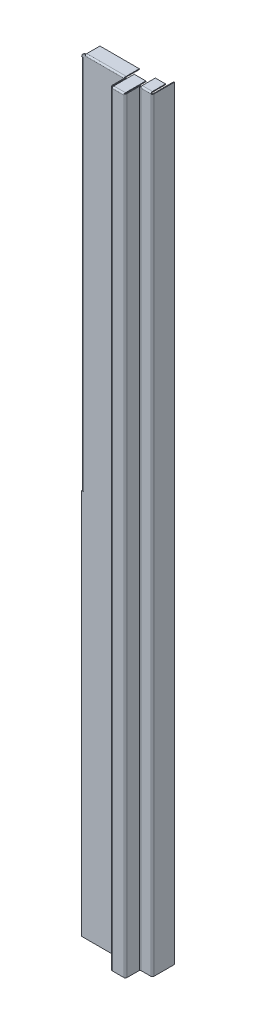
from build123d import *

# Parameters (mm, degrees)
BASE_FLANGE1_DEPTH             = 1050
CUT_EXTRUDE1_REACH             = 1056.479
EDGE_FLANGE5_STRIP_W           = 16
EDGE_FLANGE5_STRIP_H           = 1
EDGE_FLANGE5_STRIP_CUT_DEPTH   = 54
EDGE_FLANGE5_STRIP_2_W         = 16
EDGE_FLANGE5_STRIP_2_H         = 1
EDGE_FLANGE5_STRIP_CUT_2_DEPTH = 14
EDGE_FLANGE5_DEPTH             = 54
EDGE_FLANGE5_BEND_DEPTH        = 14
EDGE_FLANGE7_DEPTH             = 1048
EDGE_FLANGE8_STRIP_W           = 6
EDGE_FLANGE8_STRIP_H           = 1
EDGE_FLANGE8_STRIP_CUT_DEPTH   = 16
EDGE_FLANGE8_DEPTH             = 16
EDGE_FLANGE9_START             = 529.5
EDGE_FLANGE9_DEPTH             = 515.5
EDGE_FLANGE9_2_DEPTH           = 0.5
EDGE_FLANGE9_START_2           = 530
EDGE_FLANGE9_3_DEPTH           = 515


# Read off the part's stored shape, not the designer's step: Edge-Flange9
# Sheet-metal steps are written as plain solids
with BuildPart() as part:
    # Sketch1 → Base-Flange1 (new body)
    with BuildSketch(Plane(origin=(0, 0, 0), x_dir=(1, 0, 0), z_dir=(0, 1, 0))):
        with BuildLine():
            Line((0, 0), (-14, 0))
            ThreePointArc((-14, 0), (-14.707106781, -0.292893219), (-15, -1))
            Line((-15, -1), (-15, -18))
            ThreePointArc((-15, -18), (-15.585786438, -19.414213562), (-17, -20))
            Line((-17, -20), (-33, -20))
            ThreePointArc((-33, -20), (-34.414213562, -19.414213562), (-35, -18))
            Line((-35, -18), (-35, -1))
            ThreePointArc((-35, -1), (-35.292893219, -0.292893219), (-36, 0))
            Line((-36, 0), (-95, 0))
            Line((-95, 0), (-95, 1))
            Line((-95, 1), (-36, 1))
            ThreePointArc((-36, 1), (-34.585786438, 0.414213562), (-34, -1))
            Line((-34, -1), (-34, -18))
            ThreePointArc((-34, -18), (-33.707106781, -18.707106781), (-33, -19))
            Line((-33, -19), (-17, -19))
            ThreePointArc((-17, -19), (-16.292893219, -18.707106781), (-16, -18))
            Line((-16, -18), (-16, -1))
            ThreePointArc((-16, -1), (-15.414213562, 0.414213562), (-14, 1))
            Line((-14, 1), (0, 1))
            Line((0, 1), (0, 0))
        make_face()
    extrude(amount=BASE_FLANGE1_DEPTH)

    # Sketch18 → Cut-Extrude1 (cut, up to next)
    with BuildSketch(Plane.XY, mode=Mode.PRIVATE) as cut_extrude1_sk1:
        with BuildLine():
            Line((-95, 1045), (-95, 1050))
            Line((-95, 1050), (-90, 1050))
            ThreePointArc((-90, 1050), (-93.535533906, 1048.535533906), (-95, 1045))
        make_face()
    cut_extrude1_tool1 = extrude(cut_extrude1_sk1.sketch, amount=-CUT_EXTRUDE1_REACH, mode=Mode.PRIVATE) & part.part
    add(cut_extrude1_tool1.solids().sort_by_distance((-93.88316, 1048.88316, 0))[0], mode=Mode.SUBTRACT)

    # Edge-Flange5 strip (across the edge) → Edge-Flange5 strip cut (cut)
    with BuildSketch(Plane(origin=(-90, 1050, -1), x_dir=(0, -1, 0), z_dir=(1, 0, 0))):
        with Locations((-6, -0.5)):
            Rectangle(EDGE_FLANGE5_STRIP_W, EDGE_FLANGE5_STRIP_H)
    extrude(amount=EDGE_FLANGE5_STRIP_CUT_DEPTH, mode=Mode.SUBTRACT)

    # Edge-Flange5 strip 2 (across the edge) → Edge-Flange5 strip cut 2 (cut)
    with BuildSketch(Plane(origin=(-14, 1050, -1), x_dir=(0, -1, 0), z_dir=(1, 0, 0))):
        with Locations((-6, -0.5)):
            Rectangle(EDGE_FLANGE5_STRIP_2_W, EDGE_FLANGE5_STRIP_2_H)
    extrude(amount=EDGE_FLANGE5_STRIP_CUT_2_DEPTH, mode=Mode.SUBTRACT)

    # Edge-Flange5 section (across the edge) → Edge-Flange5 (add)
    with BuildSketch(Plane(origin=(-90, 1050, -1), x_dir=(0, -1, 0), z_dir=(1, 0, 0))):
        with BuildLine():
            Line((0, 1), (0, 19))
            Line((0, 19), (1, 19))
            Line((1, 19), (1, 1))
            ThreePointArc((1, 1), (1.292893219, 0.292893219), (2, 0))
            Line((2, 0), (2, -1))
            ThreePointArc((2, -1), (0.585786438, -0.414213562), (0, 1))
        make_face()
    extrude(amount=EDGE_FLANGE5_DEPTH)

    # Edge-Flange5 section 2 (across the edge) → Edge-Flange5 bend (add)
    with BuildSketch(Plane(origin=(-14, 1050, -1), x_dir=(0, -1, 0), z_dir=(1, 0, 0))):
        with BuildLine():
            Line((0, 1), (0, 19))
            Line((0, 19), (1, 19))
            Line((1, 19), (1, 1))
            ThreePointArc((1, 1), (1.292893219, 0.292893219), (2, 0))
            Line((2, 0), (2, -1))
            ThreePointArc((2, -1), (0.585786438, -0.414213562), (0, 1))
        make_face()
    extrude(amount=EDGE_FLANGE5_BEND_DEPTH)

    # Edge-Flange7 section (across the edge) → Edge-Flange7 (add)
    with BuildSketch(Plane(origin=(1, 1048, -1), x_dir=(-1, 0, 0), z_dir=(0, -1, 0))):
        with BuildLine():
            Line((-1, 1), (-1, 29))
            Line((-1, 29), (0, 29))
            Line((0, 29), (0, 1))
            ThreePointArc((0, 1), (0.292893219, 0.292893219), (1, 0))
            Line((1, 0), (1, -1))
            ThreePointArc((1, -1), (-0.414213562, -0.414213562), (-1, 1))
        make_face()
    extrude(amount=EDGE_FLANGE7_DEPTH)

    # Edge-Flange8 strip (across the edge) → Edge-Flange8 strip cut (cut)
    with BuildSketch(Plane(origin=(-33, 1050, 19), x_dir=(0, -1, 0), z_dir=(1, 0, 0))):
        with Locations((-1, -0.5)):
            Rectangle(EDGE_FLANGE8_STRIP_W, EDGE_FLANGE8_STRIP_H)
    extrude(amount=EDGE_FLANGE8_STRIP_CUT_DEPTH, mode=Mode.SUBTRACT)

    # Edge-Flange8 section (across the edge) → Edge-Flange8 (add)
    with BuildSketch(Plane(origin=(-33, 1050, 19), x_dir=(0, -1, 0), z_dir=(1, 0, 0))):
        with BuildLine():
            Line((0, 1), (0, 29))
            Line((0, 29), (1, 29))
            Line((1, 29), (1, 1))
            ThreePointArc((1, 1), (1.292893219, 0.292893219), (2, 0))
            Line((2, 0), (2, -1))
            ThreePointArc((2, -1), (0.585786438, -0.414213562), (0, 1))
        make_face()
    extrude(amount=EDGE_FLANGE8_DEPTH)

    # Edge-Flange9 outline → Edge-Flange9 (cut)
    with BuildSketch(Plane(origin=(0, 0, 0), x_dir=(1, 0, 0), z_dir=(0, 1, 0)).offset(EDGE_FLANGE9_START)):
        with BuildLine():
            ThreePointArc((-93, 0), (-94, 0.267949193), (-94.732050807, 1))
            Line((-94.732050807, 1), (-95, 1))
            Line((-95, 1), (-95, 0))
            Line((-95, 0), (-93, 0))
        make_face()
    extrude(amount=EDGE_FLANGE9_DEPTH, mode=Mode.SUBTRACT)

    # Edge-Flange9 2 outline → Edge-Flange9 2 (cut)
    with BuildSketch(Plane(origin=(0, 0, 0), x_dir=(1, 0, 0), z_dir=(0, 1, 0)).offset(EDGE_FLANGE9_START)):
        with BuildLine():
            Line((-92.5, 1), (-94.732050807, 1))
            ThreePointArc((-94.732050807, 1), (-94, 0.267949193), (-93, 0))
            Line((-93, 0), (-92.5, 0))
            Line((-92.5, 0), (-92.5, 1))
        make_face()
    extrude(amount=EDGE_FLANGE9_2_DEPTH, mode=Mode.SUBTRACT)

    # Edge-Flange9 3 outline → Edge-Flange9 3 (add)
    with BuildSketch(Plane(origin=(0, 0, 0), x_dir=(1, 0, 0), z_dir=(0, 1, 0)).offset(EDGE_FLANGE9_START_2)):
        with BuildLine():
            Line((-95, 21), (-95, 2))
            ThreePointArc((-95, 2), (-94.931851652, 1.48236191), (-94.732050807, 1))
            Line((-94.732050807, 1), (-93, 1))
            ThreePointArc((-93, 1), (-93.707106781, 1.292893219), (-94, 2))
            Line((-94, 2), (-94, 21))
            Line((-94, 21), (-95, 21))
        make_face()
    extrude(amount=EDGE_FLANGE9_3_DEPTH)


solid = part.part
